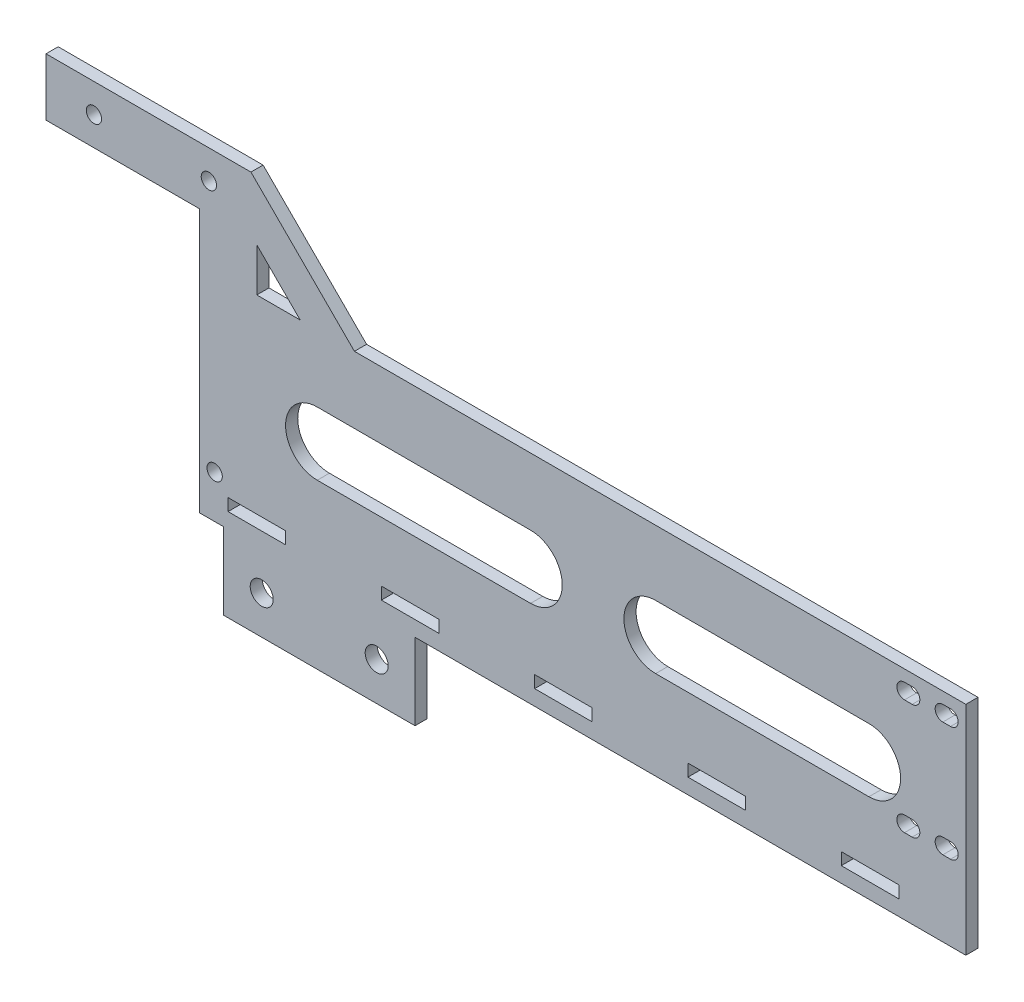
from build123d import *

# Parameters (mm, degrees)
SKETCH1_R          = 3
SKETCH1_R_2        = 2
SKETCH1_W          = 15
SKETCH1_H          = 3.175
BASE_FLANGE1_DEPTH = 3.175


# Sheet-metal steps are written as plain solids
with BuildPart() as part:
    # Sketch1 → Base-Flange1 (new body)
    with BuildSketch(Plane.XY):
        Polygon((-1.53, -68.5), (25.47, -95.5), (185, -95.5), (185, -143.5), (185, -148.5), (185, -152.205), (41.281460478, -152.205), (41.281460478, -172.205), (-8.718539522, -172.205), (-8.718539522, -152.205), (-15, -152.205), (-15, -150.03), (-15, -83.5), (-55, -83.5), (-55, -68.5), align=None)
        with Locations((1.281460478, -162.205)):
            Circle(SKETCH1_R, mode=Mode.SUBTRACT)
        with Locations((31.281460478, -162.205)):
            Circle(SKETCH1_R, mode=Mode.SUBTRACT)
        with Locations((-42.5, -76)):
            Circle(SKETCH1_R_2, mode=Mode.SUBTRACT)
        with Locations((-12.5, -76)):
            Circle(SKETCH1_R_2, mode=Mode.SUBTRACT)
        with Locations((-11, -141.03)):
            Circle(SKETCH1_R_2, mode=Mode.SUBTRACT)
        with Locations((160, -146.6175)):
            Rectangle(SKETCH1_W, SKETCH1_H, mode=Mode.SUBTRACT)
        with Locations((40, -146.6175)):
            Rectangle(SKETCH1_W, SKETCH1_H, mode=Mode.SUBTRACT)
        with Locations((0, -146.6175)):
            Rectangle(SKETCH1_W, SKETCH1_H, mode=Mode.SUBTRACT)
        Polygon((0, -84.172135624), (11.327864376, -95.5), (0, -95.5), align=None, mode=Mode.SUBTRACT)
        with Locations((80, -146.6175)):
            Rectangle(SKETCH1_W, SKETCH1_H, mode=Mode.SUBTRACT)
        with Locations((120, -146.6175)):
            Rectangle(SKETCH1_W, SKETCH1_H, mode=Mode.SUBTRACT)
        with BuildLine():
            Line((104.058089569, -112.488390285), (159.709824243, -112.488390285))
            ThreePointArc((159.709824243, -112.488390285), (167.979359115, -120.757925156), (159.709824243, -129.027460028))
            Line((159.709824243, -129.027460028), (104.058089569, -129.027460028))
            ThreePointArc((104.058089569, -129.027460028), (95.788554697, -120.757925156), (104.058089569, -112.488390285))
        make_face(mode=Mode.SUBTRACT)
        with BuildLine():
            Line((15.775217294, -112.93539217), (71.426951968, -112.93539217))
            ThreePointArc((71.426951968, -112.93539217), (79.69648684, -121.204927041), (71.426951968, -129.474461913))
            Line((71.426951968, -129.474461913), (15.775217294, -129.474461913))
            ThreePointArc((15.775217294, -129.474461913), (7.505682422, -121.204927041), (15.775217294, -112.93539217))
        make_face(mode=Mode.SUBTRACT)
        with BuildLine():
            Line((181, -102.5), (179, -102.5))
            ThreePointArc((179, -102.5), (177, -100.5), (179, -98.5))
            Line((179, -98.5), (181, -98.5))
            ThreePointArc((181, -98.5), (183, -100.5), (181, -102.5))
        make_face(mode=Mode.SUBTRACT)
        with BuildLine():
            Line((171, -102.5), (169, -102.5))
            ThreePointArc((169, -102.5), (167, -100.5), (169, -98.5))
            Line((169, -98.5), (171, -98.5))
            ThreePointArc((171, -98.5), (173, -100.5), (171, -102.5))
        make_face(mode=Mode.SUBTRACT)
        with BuildLine():
            Line((171, -128.5), (169, -128.5))
            ThreePointArc((169, -128.5), (167, -130.5), (169, -132.5))
            Line((169, -132.5), (171, -132.5))
            ThreePointArc((171, -132.5), (173, -130.5), (171, -128.5))
        make_face(mode=Mode.SUBTRACT)
        with BuildLine():
            Line((181, -128.5), (179, -128.5))
            ThreePointArc((179, -128.5), (177, -130.5), (179, -132.5))
            Line((179, -132.5), (181, -132.5))
            ThreePointArc((181, -132.5), (183, -130.5), (181, -128.5))
        make_face(mode=Mode.SUBTRACT)
    extrude(amount=-BASE_FLANGE1_DEPTH)


solid = part.part
